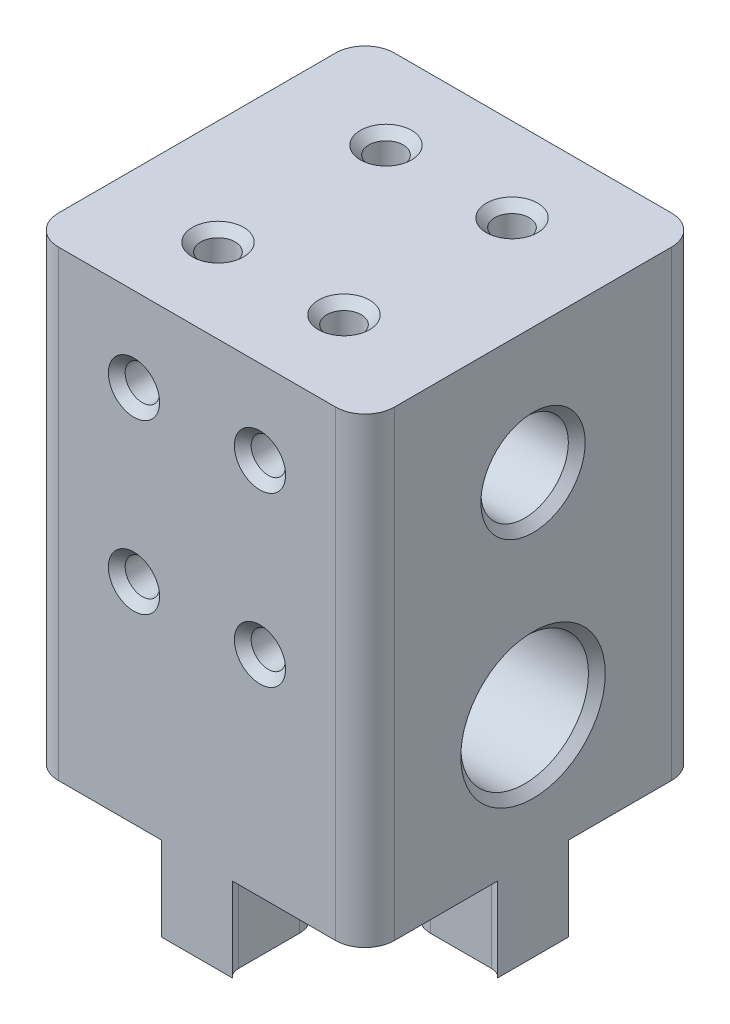
from build123d import *

# Parameters (mm, degrees)
SKETCH1_W           = 40
SKETCH1_H           = 55
SKETCH1_R           = 5.207
SKETCH1_R_2         = 7.6
BOSS_EXTRUDE1_DEPTH = 40
SKETCH1_3_R         = 11.1125
SKETCH1_3_R_2       = 5.207
CUT_EXTRUDE1_DEPTH  = 6
BOSS_EXTRUDE3_DEPTH = 16
CHAMFER1_SIZE       = 1
CUT_EXTRUDE2_START  = 6
SKETCH2_R           = 2.05
CUT_EXTRUDE2_DEPTH  = 6
SKETCH3_R           = 2.05
CUT_EXTRUDE3_DEPTH  = 6
SKETCH6_R           = 2.05
CUT_EXTRUDE5_DEPTH  = 7
FILLET2_R           = 3.5
BOSS_EXTRUDE2_DEPTH = 10
CHAMFER4_SIZE       = 1
FILLET3_R           = 3


with BuildPart() as part:
    # Sketch1 → Boss-Extrude1 (new body)
    with BuildSketch(Plane(origin=(0, 0, 0), x_dir=(0, 0, -1), z_dir=(1, 0, 0))):
        Rectangle(SKETCH1_W, SKETCH1_H)
        with Locations((0, 12.5)):
            Circle(SKETCH1_R, mode=Mode.SUBTRACT)
        with Locations((0, -12.5)):
            Circle(SKETCH1_R_2, mode=Mode.SUBTRACT)
    extrude(amount=BOSS_EXTRUDE1_DEPTH)

    # Sketch1<3> → Cut-Extrude1 (cut)
    with BuildSketch(Plane(origin=(0, 0, 0), x_dir=(0, 0, -1), z_dir=(1, 0, 0))):
        with Locations((0, 12.5)):
            Circle(SKETCH1_3_R)
        with Locations((0, 12.5)):
            Circle(SKETCH1_3_R_2, mode=Mode.SUBTRACT)
    extrude(amount=CUT_EXTRUDE1_DEPTH, mode=Mode.SUBTRACT)

    # Sketch1<4> → Boss-Extrude3 (add)
    with BuildSketch(Plane(origin=(0, 0, 0), x_dir=(0, 0, -1), z_dir=(1, 0, 0))):
        with BuildLine():
            ThreePointArc((7.6, -12.5), (5.374011537, -7.125988463), (0, -4.9))
            ThreePointArc((0, -4.9), (-5.374011537, -17.874011537), (7.6, -12.5))
        make_face()
        with BuildLine():
            ThreePointArc((4.5, -12.5), (-3.181980515, -15.681980515), (0, -8))
            ThreePointArc((0, -8), (3.181980515, -9.318019485), (4.5, -12.5))
        make_face(mode=Mode.SUBTRACT)
    extrude(amount=BOSS_EXTRUDE3_DEPTH)

    # Chamfer1
    chamfer1_edges = [part.edges().sort_by_distance(p)[0] for p in [
        (6, 12.5, 5.207),
        (0, 12.5, 11.1125),
        (40, 12.5, 5.207),
        (40, -12.5, 7.6),
    ]]
    chamfer(chamfer1_edges, length=CHAMFER1_SIZE)

    # Sketch2 → Cut-Extrude2 (cut)
    with BuildSketch(Plane(origin=(0, 0, 0), x_dir=(0, 0, -1), z_dir=(1, 0, 0)).offset(CUT_EXTRUDE2_START)):
        with Locations(Location((0, 4.65475, 0), (0, 0, 122.182106199))):
            Circle(SKETCH2_R)
        with Locations(Location((-7.84525, 12.5, 0), (0, 0, 327.817891972))):
            Circle(SKETCH2_R)
        with Locations(Location((0, 20.34525, 0), (0, 0, 237.817891972))):
            Circle(SKETCH2_R)
        with Locations(Location((7.84525, 12.5, 0), (0, 0, 212.182106199))):
            Circle(SKETCH2_R)
    extrude(amount=CUT_EXTRUDE2_DEPTH, mode=Mode.SUBTRACT)

    # Sketch3 → Cut-Extrude3 (cut)
    with BuildSketch(Plane(origin=(0, 27.5, 0), x_dir=(1, 0, 0), z_dir=(0, 1, 0))):
        with Locations(Location((12.5, 10, 0), (0, 0, 270))):
            Circle(SKETCH3_R)
        with Locations(Location((27.5, 10, 0), (0, 0, 270))):
            Circle(SKETCH3_R)
        with Locations(Location((12.5, -10, 0), (0, 0, 270))):
            Circle(SKETCH3_R)
        with Locations(Location((27.5, -10, 0), (0, 0, 270))):
            Circle(SKETCH3_R)
    extrude(amount=-CUT_EXTRUDE3_DEPTH, mode=Mode.SUBTRACT)

    # Sketch6 → Cut-Extrude5 (cut)
    with BuildSketch(Plane(origin=(0, 0, -20), x_dir=(-1, 0, 0), z_dir=(0, 0, -1))):
        with Locations((-27.5, 17.5)):
            Circle(SKETCH6_R)
        with Locations((-12.5, 17.5)):
            Circle(SKETCH6_R)
        with Locations((-27.5, -2.5)):
            Circle(SKETCH6_R)
        with Locations((-12.5, -2.5)):
            Circle(SKETCH6_R)
    cut_extrude5 = extrude(amount=-CUT_EXTRUDE5_DEPTH, mode=Mode.SUBTRACT)

    # Mirror1: Cut-Extrude5 across plane
    add(cut_extrude5.mirror(Plane.XY), mode=Mode.SUBTRACT)

    # Chamfer3: read off the stored shape, not the designer's step
    # Chamfer3: loft between two sections, ruled curve by curve
    chamfer3_from = [
        Edge.make_three_point_arc((15, -12.5, -4.5), (15, -8, 0), (15, -12.5, 4.5)),
        Edge.make_three_point_arc((15, -12.5, 4.5), (15, -17, 0), (15, -12.5, -4.5)),
    ]
    chamfer3_to = [
        Edge.make_three_point_arc((16, -12.5, -5.5), (16, -7, 0), (16, -12.5, 5.5)),
        Edge.make_three_point_arc((16, -12.5, 5.5), (16, -18, 0), (16, -12.5, -5.5)),
    ]
    chamfer3 = Solid(Shell([*[Face.make_surface_from_curves(chamfer3_from[k], chamfer3_to[k]) for k in range(2)], Face(Wire(chamfer3_from)), Face(Wire(chamfer3_to))]))
    add(chamfer3, mode=Mode.SUBTRACT)

    # Chamfer3 2: loft between two sections, ruled curve by curve
    chamfer3_2_from = [
        Edge.make_three_point_arc((1, -12.5, -4.5), (1, -17, 0), (1, -12.5, 4.5)),
        Edge.make_three_point_arc((1, -12.5, 4.5), (1, -8, 0), (1, -12.5, -4.5)),
    ]
    chamfer3_2_to = [
        Edge.make_three_point_arc((0, -12.5, -5.5), (0, -18, 0), (0, -12.5, 5.5)),
        Edge.make_three_point_arc((0, -12.5, 5.5), (0, -7, 0), (0, -12.5, -5.5)),
    ]
    chamfer3_2 = Solid(Shell([*[Face.make_surface_from_curves(chamfer3_2_from[k], chamfer3_2_to[k]) for k in range(2)], Face(Wire(chamfer3_2_from)), Face(Wire(chamfer3_2_to))]))
    add(chamfer3_2, mode=Mode.SUBTRACT)

    # Chamfer3 3: loft between two sections, ruled curve by curve
    chamfer3_3_from = [
        Edge.make_three_point_arc((7, 14.011711483, 6.460609833), (7, 11.115359819, 6.33353853), (7, 10.988288542, 9.229890194)),
        Edge.make_three_point_arc((7, 10.988288542, 9.229890194), (7, 13.884640208, 9.356961446), (7, 14.011711483, 6.460609833)),
    ]
    chamfer3_3_to = [
        Edge.make_three_point_arc((6, 14.749131718, 5.785175605), (6, 10.439925585, 5.5961183), (6, 10.250868319, 9.905324435)),
        Edge.make_three_point_arc((6, 10.250868319, 9.905324435), (6, 14.560074456, 10.094381663), (6, 14.749131718, 5.785175605)),
    ]
    chamfer3_3 = Solid(Shell([*[Face.make_surface_from_curves(chamfer3_3_from[k], chamfer3_3_to[k]) for k in range(2)], Face(Wire(chamfer3_3_from)), Face(Wire(chamfer3_3_to))]))
    add(chamfer3_3, mode=Mode.SUBTRACT)

    # Chamfer3 4: loft between two sections, ruled curve by curve
    chamfer3_4_from = [
        Edge.make_three_point_arc((7, 18.960609833, -1.511711483), (7, 18.83353853, 1.384640181), (7, 21.729890194, 1.511711458)),
        Edge.make_three_point_arc((7, 21.729890194, 1.511711458), (7, 21.856961446, -1.384640208), (7, 18.960609833, -1.511711483)),
    ]
    chamfer3_4_to = [
        Edge.make_three_point_arc((6, 18.285175605, -2.249131718), (6, 18.0961183, 2.060074415), (6, 22.405324435, 2.249131681)),
        Edge.make_three_point_arc((6, 22.405324435, 2.249131681), (6, 22.594381663, -2.060074456), (6, 18.285175605, -2.249131718)),
    ]
    chamfer3_4 = Solid(Shell([*[Face.make_surface_from_curves(chamfer3_4_from[k], chamfer3_4_to[k]) for k in range(2)], Face(Wire(chamfer3_4_from)), Face(Wire(chamfer3_4_to))]))
    add(chamfer3_4, mode=Mode.SUBTRACT)

    # Chamfer3 5: loft between two sections, ruled curve by curve
    chamfer3_5_from = [
        Edge.make_three_point_arc((7, 10.988288517, -6.460609833), (7, 13.884640181, -6.33353853), (7, 14.011711458, -9.229890194)),
        Edge.make_three_point_arc((7, 14.011711458, -9.229890194), (7, 11.115359792, -9.356961446), (7, 10.988288517, -6.460609833)),
    ]
    chamfer3_5_to = [
        Edge.make_three_point_arc((6, 10.250868282, -5.785175605), (6, 14.560074415, -5.5961183), (6, 14.749131681, -9.905324435)),
        Edge.make_three_point_arc((6, 14.749131681, -9.905324435), (6, 10.439925544, -10.094381663), (6, 10.250868282, -5.785175605)),
    ]
    chamfer3_5 = Solid(Shell([*[Face.make_surface_from_curves(chamfer3_5_from[k], chamfer3_5_to[k]) for k in range(2)], Face(Wire(chamfer3_5_from)), Face(Wire(chamfer3_5_to))]))
    add(chamfer3_5, mode=Mode.SUBTRACT)

    # Chamfer3 6: loft between two sections, ruled curve by curve
    chamfer3_6_from = [
        Edge.make_three_point_arc((7, 6.039390167, 1.511711483), (7, 6.16646147, -1.384640181), (7, 3.270109806, -1.511711458)),
        Edge.make_three_point_arc((7, 3.270109806, -1.511711458), (7, 3.143038554, 1.384640208), (7, 6.039390167, 1.511711483)),
    ]
    chamfer3_6_to = [
        Edge.make_three_point_arc((6, 6.714824395, 2.249131718), (6, 6.9038817, -2.060074415), (6, 2.594675565, -2.249131681)),
        Edge.make_three_point_arc((6, 2.594675565, -2.249131681), (6, 2.405618337, 2.060074456), (6, 6.714824395, 2.249131718)),
    ]
    chamfer3_6 = Solid(Shell([*[Face.make_surface_from_curves(chamfer3_6_from[k], chamfer3_6_to[k]) for k in range(2)], Face(Wire(chamfer3_6_from)), Face(Wire(chamfer3_6_to))]))
    add(chamfer3_6, mode=Mode.SUBTRACT)

    # Fillet2
    fillet2_edges = [part.edges().sort_by_distance(p)[0] for p in [
        (40, 0, -20),
        (40, 0, 20),
        (0, 0, 20),
        (0, 0, -20),
    ]]
    fillet(fillet2_edges, radius=FILLET2_R)

    # Sketch5 → Boss-Extrude2 (add)
    with BuildSketch(Plane.XZ.offset(27.5)):
        with BuildLine():
            Line((16.4, 18.68), (16.4, 8.4))
            Line((16.4, 8.4), (23.6, 8.4))
            Line((23.6, 8.4), (23.6, 18.68))
            ThreePointArc((23.6, 18.68), (23.761942699, 19.408599647), (24.2172761, 20))
            Line((24.2172761, 20), (15.7827239, 20))
            ThreePointArc((15.7827239, 20), (16.238057301, 19.408599647), (16.4, 18.68))
        make_face()
        with BuildLine():
            ThreePointArc((1.32, 3.6), (0.591400353, 3.761942699), (0, 4.2172761))
            Line((0, 4.2172761), (0, -4.2172761))
            ThreePointArc((0, -4.2172761), (0.591400353, -3.761942699), (1.32, -3.6))
            Line((1.32, -3.6), (11.6, -3.6))
            Line((11.6, -3.6), (11.6, 3.6))
            Line((11.6, 3.6), (1.32, 3.6))
        make_face()
        with BuildLine():
            Line((40, -4.2172761), (40, 4.2172761))
            ThreePointArc((40, 4.2172761), (39.408599647, 3.761942699), (38.68, 3.6))
            Line((38.68, 3.6), (28.4, 3.6))
            Line((28.4, 3.6), (28.4, -3.6))
            Line((28.4, -3.6), (38.68, -3.6))
            ThreePointArc((38.68, -3.6), (39.408599647, -3.761942699), (40, -4.2172761))
        make_face()
        with BuildLine():
            ThreePointArc((16.4, -18.68), (16.238057301, -19.408599647), (15.7827239, -20))
            Line((15.7827239, -20), (24.2172761, -20))
            ThreePointArc((24.2172761, -20), (23.761942699, -19.408599647), (23.6, -18.68))
            Line((23.6, -18.68), (23.6, -8.4))
            Line((23.6, -8.4), (16.4, -8.4))
            Line((16.4, -8.4), (16.4, -18.68))
        make_face()
    extrude(amount=BOSS_EXTRUDE2_DEPTH)

    # Chamfer4
    chamfer4_edges = [part.edges().sort_by_distance(p)[0] for p in [
        (29.55, -2.5, -20),
        (14.55, -2.5, -20),
        (29.55, 17.5, -20),
        (14.55, 17.5, 20),
        (29.55, -2.5, 20),
        (14.55, -2.5, 20),
        (29.55, 17.5, 20),
        (27.5, 27.5, -12.05),
        (12.5, 27.5, 7.95),
        (27.5, 27.5, 7.95),
        (12.5, 27.5, -12.05),
        (14.55, 17.5, -20),
    ]]
    chamfer(chamfer4_edges, length=CHAMFER4_SIZE)

    # Fillet3
    fillet3_edges = [part.edges().sort_by_distance(p)[0] for p in [
        (16.4, -32.5, 8.4),
        (23.6, -32.5, 8.4),
        (11.6, -32.5, -3.6),
        (11.6, -32.5, 3.6),
        (28.4, -32.5, 3.6),
        (28.4, -32.5, -3.6),
        (23.6, -32.5, -8.4),
        (16.4, -32.5, -8.4),
    ]]
    fillet(fillet3_edges, radius=FILLET3_R)


solid = part.part
